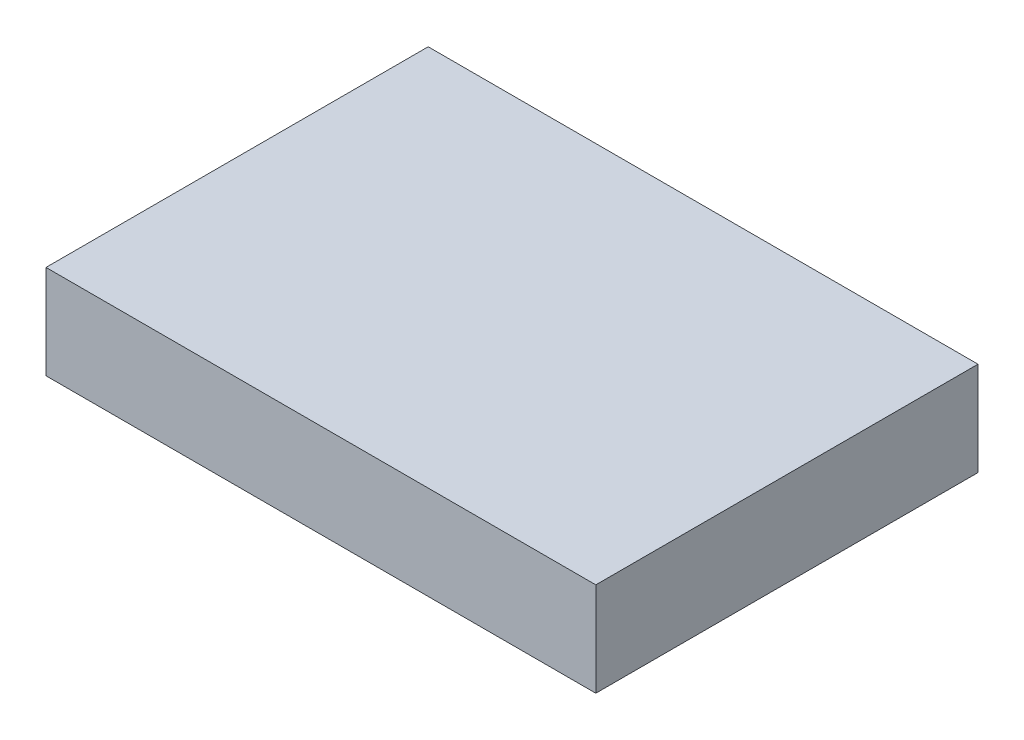
from build123d import *

# Parameters (mm, degrees)
SKETCH_1_W      = 82
SKETCH_1_H      = 57
EXTRUDE_1_DEPTH = 14


with BuildPart() as part:
    # 草图1 → 凸台-拉伸1 (new body)
    with BuildSketch(Plane(origin=(0, 0, 0), x_dir=(1, 0, 0), z_dir=(0, 1, 0))):
        Rectangle(SKETCH_1_W, SKETCH_1_H)
    extrude(amount=EXTRUDE_1_DEPTH)


solid = part.part
